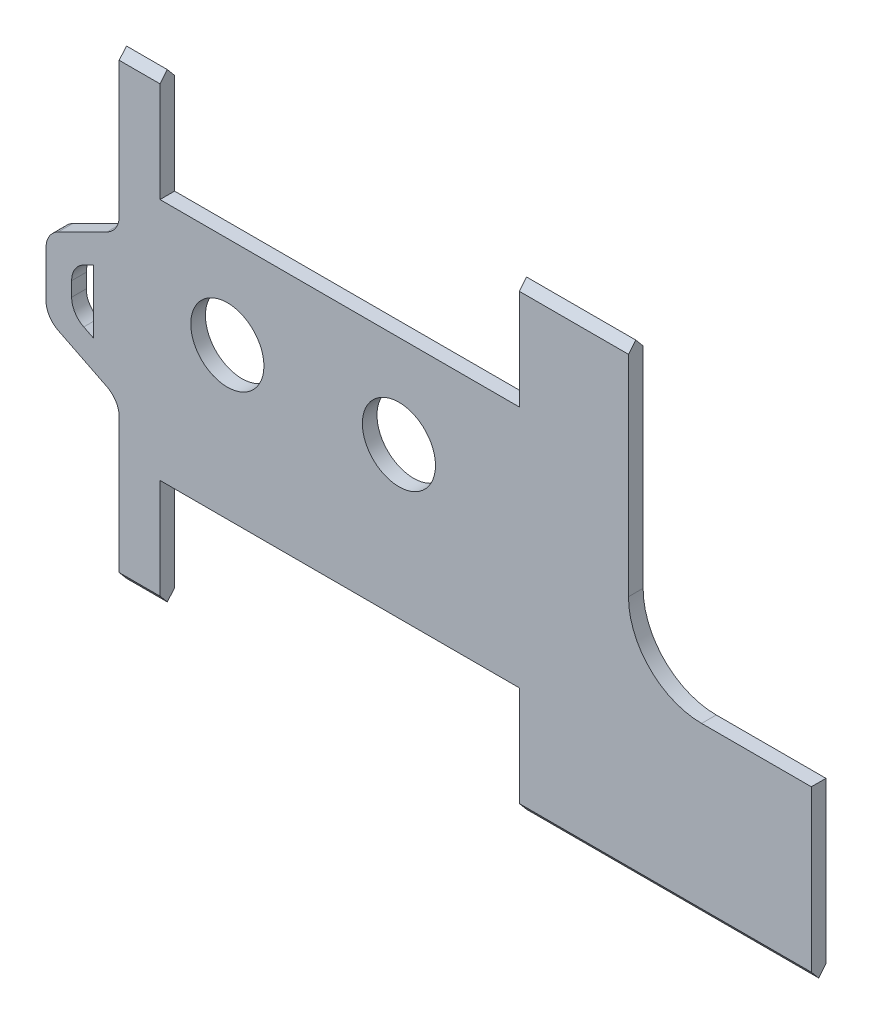
from build123d import *

# Parameters (mm, degrees)
SKETCH1_R           = 5
BOSS_EXTRUDE1_DEPTH = 1
CUT_EXTRUDE1_DEPTH  = 161.061343452
FILLET1_R           = 10
FILLET2_R           = 3


with BuildPart() as part:
    # Sketch1 → Boss-Extrude1 (new, symmetric)
    with BuildSketch(Plane.XY.offset(11.1483132)):
        Polygon((12.423, 91.8975), (22.423, 86.8975), (22.423, 65.272), (28.004997253, 65.272), (28.004997253, 80.272), (77.123000954, 80.272), (77.123000954, 65.272), (117.048, 65.272), (117.048, 88.523), (92.048, 88.523), (92.048, 128.523), (77.123000954, 128.523), (77.123000954, 113.523), (28.004997253, 113.523), (28.004997253, 128.523), (22.423, 128.523), (22.423, 106.8975), (12.423, 101.8975), align=None)
        Polygon((18.923, 92.560618961), (15.923, 94.060618961), (15.923, 99.734381039), (18.923, 101.234381039), align=None, mode=Mode.SUBTRACT)
        with Locations((60.666202545, 100.85559845)):
            Circle(SKETCH1_R, mode=Mode.SUBTRACT)
        with Locations((37.210998535, 100.914199829)):
            Circle(SKETCH1_R, mode=Mode.SUBTRACT)
    extrude(amount=BOSS_EXTRUDE1_DEPTH, both=True)

    # Sketch2 → Cut-Extrude1 (cut, through all)
    with BuildSketch(Plane.ZY.offset(-22.423)):
        Polygon((10.101339955, 128.523), (10.101339955, 127.168225732), (11.1483132, 128.412378938), (12.195286445, 127.168225732), (12.195286445, 128.523), align=None)
        Polygon((12.195286445, 66.626774268), (12.195286445, 65.272), (10.101339955, 65.272), (10.101339955, 66.626774268), (11.1483132, 65.382621062), align=None)
    extrude(amount=-CUT_EXTRUDE1_DEPTH, mode=Mode.SUBTRACT)

    # Fillet1
    fillet1_edges = [part.edges().sort_by_distance(p)[0] for p in [
        (92.048, 88.523, 11.1483132),
    ]]
    fillet(fillet1_edges, radius=FILLET1_R)

    # Fillet2
    fillet2_edges = [part.edges().sort_by_distance(p)[0] for p in [
        (15.923, 99.734381039, 11.1483132),
        (15.923, 94.060618961, 11.1483132),
        (22.423, 106.8975, 11.1483132),
        (12.423, 101.8975, 11.1483132),
        (12.423, 91.8975, 11.1483132),
        (22.423, 86.8975, 11.1483132),
    ]]
    fillet(fillet2_edges, radius=FILLET2_R)


solid = part.part
